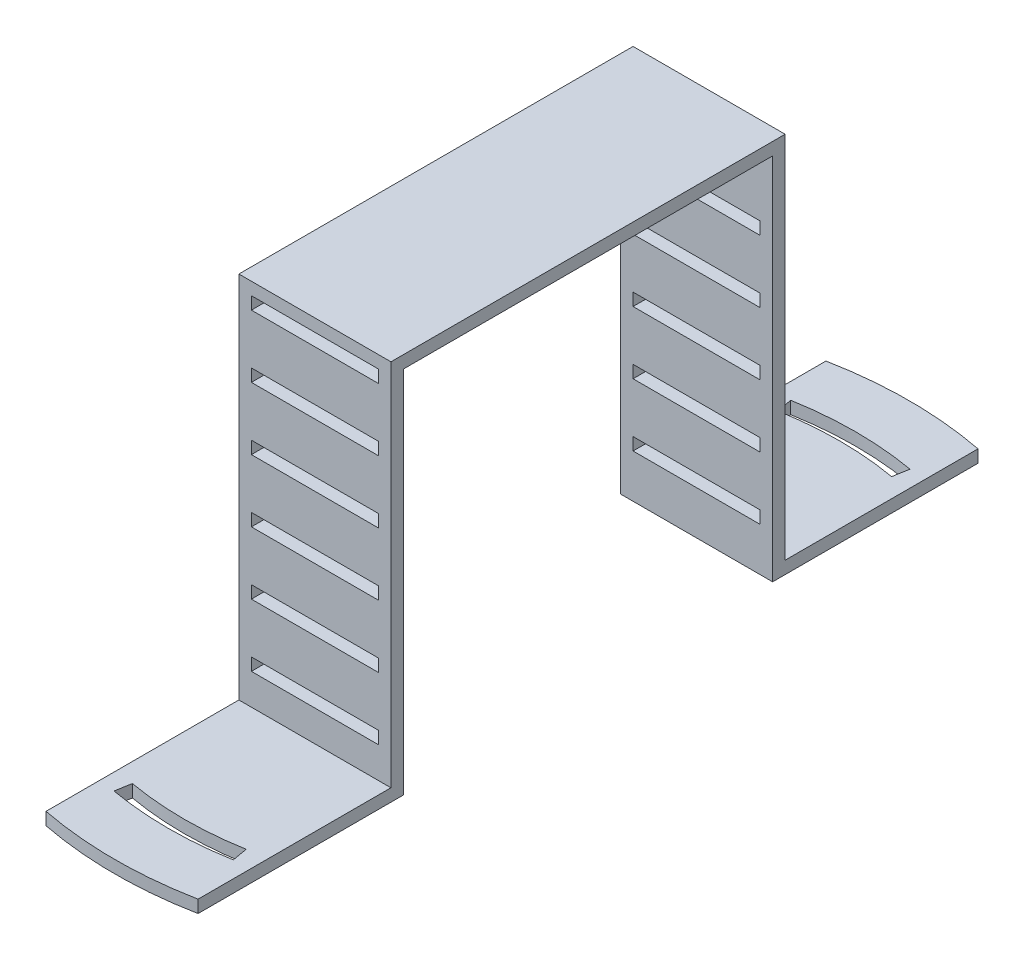
from build123d import *

# Parameters (mm, degrees)
SKETCH1_R            = 1.5875
BOSS_EXTRUDE5_DEPTH  = 1.5875
FILLET2_R            = 2.54
FILLET3_R            = 2.54
FILLET4_R            = 5.08
CUT_EXTRUDE1_START   = -2.54
SKETCH2_R            = 2.38125
SKETCH2_R_2          = 1.5875
CUT_EXTRUDE1_DEPTH   = 2.54
SKETCH3_R            = 1.5875
CUT_EXTRUDE2_DEPTH   = 2.54
CUT_EXTRUDE3_DEPTH   = 2.54
SKETCH5_W            = 15
SKETCH5_H            = 34.925
CUT_EXTRUDE4_DEPTH   = 109.650407999
FILLET5_R            = 7.62
FILLET6_R            = 7.62
BOSS_EXTRUDE6_START  = -1.5875
BOSS_EXTRUDE6_DEPTH  = 1.5875
SKETCH7_R            = 79.375
CUT_EXTRUDE5_DEPTH   = 0.5875
BOSS_EXTRUDE7_START  = -1
SKETCH8_R            = 1.5875
SKETCH8_R_2          = 2.38125
BOSS_EXTRUDE7_DEPTH  = 1
SKETCH9_R            = 1.5875
CUT_EXTRUDE7_DEPTH   = 2.54
BOSS_EXTRUDE8_START  = -1
BOSS_EXTRUDE8_DEPTH  = 1
CUT_EXTRUDE9_START   = -2.54
CUT_EXTRUDE9_DEPTH   = 2.54
BOSS_EXTRUDE9_START  = -1
BOSS_EXTRUDE9_DEPTH  = 1
CUT_EXTRUDE10_START  = -2.54
CUT_EXTRUDE10_DEPTH  = 2.54
BOSS_EXTRUDE10_START = -1
BOSS_EXTRUDE10_DEPTH = 1
CUT_EXTRUDE11_START  = -2.54
CUT_EXTRUDE11_DEPTH  = 2.54
BOSS_EXTRUDE11_START = -1
BOSS_EXTRUDE11_DEPTH = 1
BOSS_EXTRUDE13_DEPTH = 2.5
SKETCH19_W           = 73.75
SKETCH19_H           = 2.5
SKETCH19_W_2         = 2.5
SKETCH19_H_2         = 76.2
BOSS_EXTRUDE14_DEPTH = 30.380450628
CUT_EXTRUDE12_START  = -2.5
SKETCH20_R           = 79.375
CUT_EXTRUDE12_DEPTH  = 2.5
SKETCH21_W           = 25.380450628
SKETCH21_H           = 2.5
CUT_EXTRUDE15_DEPTH  = 143.7697468


with BuildPart() as part:
    # Sketch1 → Boss-Extrude5 (new body)
    with BuildSketch(Plane(origin=(0, 0, 0), x_dir=(1, 0, 0), z_dir=(0, 1, 0))):
        with BuildLine():
            ThreePointArc((-63.5, -47.625), (-35.497579143, -70.995158286), (0, -79.375))
            ThreePointArc((0, -79.375), (35.497579143, -70.995158286), (63.5, -47.625))
            Line((63.5, -47.625), (50.8, -47.625))
            Line((50.8, -47.625), (50.8, 22.225))
            Line((50.8, 22.225), (76.2, 22.225))
            ThreePointArc((76.2, 22.225), (0, 79.375), (-76.2, 22.225))
            Line((-76.2, 22.225), (-50.8, 22.225))
            Line((-50.8, 22.225), (-50.8, -47.625))
            Line((-50.8, -47.625), (-63.5, -47.625))
        make_face()
        with Locations(Location((-7.14375, -66.675, 0), (0, 0, 270))):
            Circle(SKETCH1_R, mode=Mode.SUBTRACT)
        with BuildLine():
            ThreePointArc((8.73125, -66.675), (7.14375, -68.2625), (5.55625, -66.675))
            ThreePointArc((5.55625, -66.675), (7.14375, -65.0875), (8.73125, -66.675))
        make_face(mode=Mode.SUBTRACT)
        with Locations(Location((-7.14375, 66.675, 0), (0, 0, 270))):
            Circle(SKETCH1_R, mode=Mode.SUBTRACT)
        with Locations(Location((7.14375, 66.675, 0), (0, 0, 270))):
            Circle(SKETCH1_R, mode=Mode.SUBTRACT)
    extrude(amount=BOSS_EXTRUDE5_DEPTH)

    # Fillet2
    fillet2_edges = [part.edges().sort_by_distance(p)[0] for p in [
        (-63.5, 0.79375, 47.625),
    ]]
    fillet(fillet2_edges, radius=FILLET2_R)

    # Fillet3
    fillet3_edges = [part.edges().sort_by_distance(p)[0] for p in [
        (63.5, 0.79375, 47.625),
    ]]
    fillet(fillet3_edges, radius=FILLET3_R)

    # Fillet4
    fillet4_edges = [part.edges().sort_by_distance(p)[0] for p in [
        (-76.2, 0.79375, -22.225),
        (76.2, 0.79375, -22.225),
    ]]
    fillet(fillet4_edges, radius=FILLET4_R)

    # Sketch2 → Cut-Extrude1 (cut)
    # profile 1 of 10: a face of its own
    with BuildSketch(Plane(origin=(0, 1.5875, 0), x_dir=(1, 0, 0), z_dir=(0, 1, 0)).offset(CUT_EXTRUDE1_START)):
        with BuildLine():
            Line((-61.088622125, 27.654457796), (-59.642408406, 26.999765402))
            ThreePointArc((-59.642408406, 26.999765402), (-52.384826382, 39.268743005), (-42.643785254, 49.676068599))
            Line((-42.643785254, 49.676068599), (-43.677815048, 50.880617741))
            Line((-43.677815048, 50.880617741), (-44.711844841, 52.085166883))
            ThreePointArc((-44.711844841, 52.085166883), (-54.925289002, 41.173126022), (-62.534835843, 28.309150189))
            Line((-62.534835843, 28.309150189), (-61.088622125, 27.654457796))
        make_face()
    # profile 2 of 10: a face of its own
    with BuildSketch(Plane(origin=(0, 1.5875, 0), x_dir=(1, 0, 0), z_dir=(0, 1, 0)).offset(CUT_EXTRUDE1_START)):
        with BuildLine():
            Line((-39.077069744, 54.493774041), (-38.151958122, 53.203686937))
            ThreePointArc((-38.151958122, 53.203686937), (-25.732218917, 60.200142208), (-12.092567045, 64.342629994))
            Line((-12.092567045, 64.342629994), (-12.385788543, 65.902815048))
            Line((-12.385788543, 65.902815048), (-12.679010041, 67.463000102))
            ThreePointArc((-12.679010041, 67.463000102), (-26.980132574, 63.119617589), (-40.002181367, 55.783861145))
            Line((-40.002181367, 55.783861145), (-39.077069744, 54.493774041))
        make_face()
    # profile 3 of 10: a face of its own
    with BuildSketch(Plane(origin=(0, 1.5875, 0), x_dir=(1, 0, 0), z_dir=(0, 1, 0)).offset(CUT_EXTRUDE1_START)):
        with Locations(Location((-7.14375, 66.675, 0), (0, 0, 270))):
            Circle(SKETCH2_R)
        with Locations((-7.14375, 66.675)):
            Circle(SKETCH2_R_2, mode=Mode.SUBTRACT)
    # profile 4 of 10: a face of its own
    with BuildSketch(Plane(origin=(0, 1.5875, 0), x_dir=(1, 0, 0), z_dir=(0, 1, 0)).offset(CUT_EXTRUDE1_START)):
        with Locations(Location((7.14375, 66.675, 0), (0, 0, 270))):
            Circle(SKETCH2_R)
        with Locations((7.14375, 66.675)):
            Circle(SKETCH2_R_2, mode=Mode.SUBTRACT)
    # profile 5 of 10: a face of its own
    with BuildSketch(Plane(origin=(0, 1.5875, 0), x_dir=(1, 0, 0), z_dir=(0, 1, 0)).offset(CUT_EXTRUDE1_START)):
        with BuildLine():
            ThreePointArc((12.679010041, 67.463000102), (26.980132574, 63.119617589), (40.002181367, 55.783861145))
            Line((40.002181367, 55.783861145), (39.077069744, 54.493774041))
            Line((39.077069744, 54.493774041), (38.151958122, 53.203686937))
            ThreePointArc((38.151958122, 53.203686937), (25.732218917, 60.200142208), (12.092567045, 64.342629994))
            Line((12.092567045, 64.342629994), (12.385788543, 65.902815048))
            Line((12.385788543, 65.902815048), (12.679010041, 67.463000102))
        make_face()
    # profile 6 of 10: a face of its own
    with BuildSketch(Plane(origin=(0, 1.5875, 0), x_dir=(1, 0, 0), z_dir=(0, 1, 0)).offset(CUT_EXTRUDE1_START)):
        with BuildLine():
            ThreePointArc((44.711844841, 52.085166883), (54.925289002, 41.173126022), (62.534835843, 28.309150189))
            Line((62.534835843, 28.309150189), (59.642408406, 26.999765402))
            ThreePointArc((59.642408406, 26.999765402), (52.384826382, 39.268743005), (42.643785254, 49.676068599))
            Line((42.643785254, 49.676068599), (43.677815048, 50.880617741))
            Line((43.677815048, 50.880617741), (44.711844841, 52.085166883))
        make_face()
    # profile 7 of 10: a face of its own
    with BuildSketch(Plane(origin=(0, 1.5875, 0), x_dir=(1, 0, 0), z_dir=(0, 1, 0)).offset(CUT_EXTRUDE1_START)):
        with BuildLine():
            ThreePointArc((-12.679010041, -67.463000102), (-26.980132574, -63.119617589), (-40.002181367, -55.783861145))
            Line((-40.002181367, -55.783861145), (-39.077069744, -54.493774041))
            Line((-39.077069744, -54.493774041), (-38.151958122, -53.203686937))
            ThreePointArc((-38.151958122, -53.203686937), (-25.732218917, -60.200142208), (-12.092567045, -64.342629994))
            Line((-12.092567045, -64.342629994), (-12.385788543, -65.902815048))
            Line((-12.385788543, -65.902815048), (-12.679010041, -67.463000102))
        make_face()
    # profile 8 of 10: a face of its own
    with BuildSketch(Plane(origin=(0, 1.5875, 0), x_dir=(1, 0, 0), z_dir=(0, 1, 0)).offset(CUT_EXTRUDE1_START)):
        with Locations(Location((-7.14375, -66.675, 0), (0, 0, 270))):
            Circle(SKETCH2_R)
        with Locations((-7.14375, -66.675)):
            Circle(SKETCH2_R_2, mode=Mode.SUBTRACT)
    # profile 9 of 10: a face of its own
    with BuildSketch(Plane(origin=(0, 1.5875, 0), x_dir=(1, 0, 0), z_dir=(0, 1, 0)).offset(CUT_EXTRUDE1_START)):
        with Locations(Location((7.14375, -66.675, 0), (0, 0, 270))):
            Circle(SKETCH2_R)
        with Locations((7.14375, -66.675)):
            Circle(SKETCH2_R_2, mode=Mode.SUBTRACT)
    # profile 10 of 10: a face of its own
    with BuildSketch(Plane(origin=(0, 1.5875, 0), x_dir=(1, 0, 0), z_dir=(0, 1, 0)).offset(CUT_EXTRUDE1_START)):
        with BuildLine():
            ThreePointArc((12.092567045, -64.342629994), (25.732218917, -60.200142208), (38.151958122, -53.203686937))
            Line((38.151958122, -53.203686937), (39.077069744, -54.493774041))
            Line((39.077069744, -54.493774041), (40.002181367, -55.783861145))
            ThreePointArc((40.002181367, -55.783861145), (26.980132574, -63.119617589), (12.679010041, -67.463000102))
            Line((12.679010041, -67.463000102), (12.385788543, -65.902815048))
            Line((12.385788543, -65.902815048), (12.092567045, -64.342629994))
        make_face()
    extrude(amount=CUT_EXTRUDE1_DEPTH, mode=Mode.SUBTRACT)

    # Sketch3 → Cut-Extrude2 (cut)
    with BuildSketch(Plane(origin=(0, 1.5875, 0), x_dir=(1, 0, 0), z_dir=(0, 1, 0))):
        with Locations(Location((-44.45, -47.625, 0), (0, 0, 270))):
            Circle(SKETCH3_R)
        with Locations(Location((-44.45, 22.225, 0), (0, 0, 270))):
            Circle(SKETCH3_R)
        with Locations(Location((44.45, 22.225, 0), (0, 0, 270))):
            Circle(SKETCH3_R)
        with Locations(Location((44.45, -47.625, 0), (0, 0, 270))):
            Circle(SKETCH3_R)
    extrude(amount=-CUT_EXTRUDE2_DEPTH, mode=Mode.SUBTRACT)

    # Sketch4 → Cut-Extrude3 (cut)
    with BuildSketch(Plane(origin=(0, 1.5875, 0), x_dir=(1, 0, 0), z_dir=(0, 1, 0))):
        with BuildLine():
            ThreePointArc((-44.45, -11.1125), (-46.0375, -12.7), (-44.45, -14.2875))
            Line((-44.45, -14.2875), (-44.45, -11.1125))
        make_face()
        with BuildLine():
            Line((-44.45, -11.1125), (-44.45, -14.2875))
            ThreePointArc((-44.45, -14.2875), (-43.327467985, -13.822532015), (-42.8625, -12.7))
            ThreePointArc((-42.8625, -12.7), (-43.327467985, -11.577467985), (-44.45, -11.1125))
        make_face()
        with BuildLine():
            ThreePointArc((44.45, -11.1125), (42.8625, -12.7), (44.45, -14.2875))
            Line((44.45, -14.2875), (44.45, -11.1125))
        make_face()
        with BuildLine():
            Line((44.45, -11.1125), (44.45, -14.2875))
            ThreePointArc((44.45, -14.2875), (45.572532015, -13.822532015), (46.0375, -12.7))
            ThreePointArc((46.0375, -12.7), (45.572532015, -11.577467985), (44.45, -11.1125))
        make_face()
    extrude(amount=-CUT_EXTRUDE3_DEPTH, mode=Mode.SUBTRACT)

    # Sketch5 → Cut-Extrude4 (cut, through all)
    with BuildSketch(Plane(origin=(0, 1.5875, 0), x_dir=(1, 0, 0), z_dir=(0, 1, 0))):
        with Locations((-27.3, 4.7625)):
            Rectangle(SKETCH5_W, SKETCH5_H)
        with Locations((27.3, 4.7625)):
            Rectangle(SKETCH5_W, SKETCH5_H)
    extrude(amount=-CUT_EXTRUDE4_DEPTH, mode=Mode.SUBTRACT)

    # Fillet5
    # the kernel refuses this fillet: 7.62 mm, written as the material it adds along each edge
    with BuildSketch(Plane(origin=(-19.8, 1.5875, 12.7), x_dir=(0, 0, -1), z_dir=(0, -1, 0))) as fillet5_piece_1:
        with BuildLine():
            CenterArc((FILLET5_R, -FILLET5_R), FILLET5_R, 90, 90)
            Line((0, -FILLET5_R), (0, 0))
            Line((0, 0), (FILLET5_R, 0))
        make_face()
    extrude(amount=1.5875)
    with BuildSketch(Plane(origin=(-34.8, 1.5875, 12.7), x_dir=(0, 0, -1), z_dir=(0, -1, 0)), Plane(origin=(-19.8, 1.5875, -22.225), x_dir=(0, 0, 1), z_dir=(0, -1, 0)), Plane(origin=(-34.8, 1.5875, -22.225), x_dir=(1, 0, 0), z_dir=(0, -1, 0))) as fillet5_piece_2:
        with BuildLine():
            CenterArc((FILLET5_R, FILLET5_R), FILLET5_R, 180, 90)
            Line((0, FILLET5_R), (0, 0))
            Line((0, 0), (FILLET5_R, 0))
        make_face()
    extrude(amount=1.5875)

    # Fillet6
    # the kernel refuses this fillet: 7.62 mm, written as the material it adds along each edge
    with BuildSketch(Plane(origin=(34.8, 1.5875, 12.7), x_dir=(0, 0, -1), z_dir=(0, -1, 0)), Plane(origin=(34.8, 1.5875, -22.225), x_dir=(-1, 0, 0), z_dir=(0, -1, 0))) as fillet6_piece_1:
        with BuildLine():
            CenterArc((FILLET6_R, -FILLET6_R), FILLET6_R, 90, 90)
            Line((0, -FILLET6_R), (0, 0))
            Line((0, 0), (FILLET6_R, 0))
        make_face()
    extrude(amount=1.5875)
    with BuildSketch(Plane(origin=(19.8, 1.5875, -22.225), x_dir=(1, 0, 0), z_dir=(0, -1, 0)), Plane(origin=(19.8, 1.5875, 12.7), x_dir=(0, 0, -1), z_dir=(0, -1, 0))) as fillet6_piece_2:
        with BuildLine():
            CenterArc((FILLET6_R, FILLET6_R), FILLET6_R, 180, 90)
            Line((0, FILLET6_R), (0, 0))
            Line((0, 0), (FILLET6_R, 0))
        make_face()
    extrude(amount=1.5875)

    # Sketch6 → Boss-Extrude6 (add)
    with BuildSketch(Plane(origin=(0, 1.5875, 0), x_dir=(1, 0, 0), z_dir=(0, 1, 0)).offset(BOSS_EXTRUDE6_START)):
        with BuildLine():
            Line((-50.8, -60.989758362), (-50.8, 22.225))
            Line((-50.8, 22.225), (-69.095470184, 22.225))
            Line((-69.095470184, 22.225), (-69.095470184, 39.066694575))
            ThreePointArc((-69.095470184, 39.066694575), (-78.080435361, -14.277122916), (-50.8, -60.989758362))
        make_face()
        with BuildLine():
            Line((50.8, 22.225), (50.8, -60.989758362))
            ThreePointArc((50.8, -60.989758362), (71.877119534, -33.675960454), (79.375, 0))
            ThreePointArc((79.375, 0), (76.762111653, 20.198238526), (69.095470184, 39.066694575))
            Line((69.095470184, 39.066694575), (69.095470184, 22.225))
            Line((69.095470184, 22.225), (50.8, 22.225))
        make_face()
    extrude(amount=BOSS_EXTRUDE6_DEPTH)

    # Sketch7 → Cut-Extrude5 (cut)
    with BuildSketch(Plane.XZ):
        with Locations(Location((0, 0, 0), (0, 0, 270))):
            Circle(SKETCH7_R)
    extrude(amount=-CUT_EXTRUDE5_DEPTH, mode=Mode.SUBTRACT)

    # Sketch8 → Boss-Extrude7 (add)
    with BuildSketch(Plane(origin=(0, 1.5875, 0), x_dir=(1, 0, 0), z_dir=(0, 1, 0)).offset(BOSS_EXTRUDE7_START)):
        with Locations((-44.45, -12.7)):
            Circle(SKETCH8_R)
        with Locations((44.45, -12.7)):
            Circle(SKETCH8_R)
        with Locations((-7.14375, -66.675)):
            Circle(SKETCH8_R_2)
        with Locations((7.14375, -66.675)):
            Circle(SKETCH8_R_2)
        with Locations((-7.14375, 66.675)):
            Circle(SKETCH8_R_2)
        with Locations((7.14375, 66.675)):
            Circle(SKETCH8_R_2)
    extrude(amount=BOSS_EXTRUDE7_DEPTH)

    # Sketch9 → Cut-Extrude7 (cut)
    with BuildSketch(Plane(origin=(0, 1.5875, 0), x_dir=(1, 0, 0), z_dir=(0, 1, 0))):
        with Locations(Location((-44.45, -1.058333333, 0), (0, 0, 270))):
            Circle(SKETCH9_R)
        with Locations(Location((-44.45, -24.341666667, 0), (0, 0, 270))):
            Circle(SKETCH9_R)
        with Locations(Location((44.45, -24.341666667, 0), (0, 0, 270))):
            Circle(SKETCH9_R)
        with Locations(Location((44.45, -1.058333333, 0), (0, 0, 270))):
            Circle(SKETCH9_R)
    extrude(amount=-CUT_EXTRUDE7_DEPTH, mode=Mode.SUBTRACT)

    # Sketch10 → Boss-Extrude8 (add)
    with BuildSketch(Plane(origin=(0, 1.5875, 0), x_dir=(1, 0, 0), z_dir=(0, 1, 0)).offset(BOSS_EXTRUDE8_START)):
        with BuildLine():
            Line((-44.711844841, 52.085166883), (-42.643785254, 49.676068599))
            ThreePointArc((-42.643785254, 49.676068599), (-52.384826382, 39.268743005), (-59.642408406, 26.999765402))
            Line((-59.642408406, 26.999765402), (-62.534835843, 28.309150189))
            ThreePointArc((-62.534835843, 28.309150189), (-54.925289002, 41.173126022), (-44.711844841, 52.085166883))
        make_face()
        with BuildLine():
            Line((-12.679010041, 67.463000102), (-12.092567045, 64.342629994))
            ThreePointArc((-12.092567045, 64.342629994), (-25.732218917, 60.200142208), (-38.151958122, 53.203686937))
            Line((-38.151958122, 53.203686937), (-40.002181367, 55.783861145))
            ThreePointArc((-40.002181367, 55.783861145), (-26.980132574, 63.119617589), (-12.679010041, 67.463000102))
        make_face()
        with BuildLine():
            Line((12.092567045, 64.342629994), (12.679010041, 67.463000102))
            ThreePointArc((12.679010041, 67.463000102), (26.980132574, 63.119617589), (40.002181367, 55.783861145))
            Line((40.002181367, 55.783861145), (38.151958122, 53.203686937))
            ThreePointArc((38.151958122, 53.203686937), (25.732218917, 60.200142208), (12.092567045, 64.342629994))
        make_face()
        with BuildLine():
            Line((42.643785254, 49.676068599), (44.711844841, 52.085166883))
            ThreePointArc((44.711844841, 52.085166883), (54.925289002, 41.173126022), (62.534835843, 28.309150189))
            Line((62.534835843, 28.309150189), (59.642408406, 26.999765402))
            ThreePointArc((59.642408406, 26.999765402), (52.384826382, 39.268743005), (42.643785254, 49.676068599))
        make_face()
    extrude(amount=BOSS_EXTRUDE8_DEPTH)

    # Sketch11 → Cut-Extrude9 (cut)
    with BuildSketch(Plane(origin=(0, 1.5875, 0), x_dir=(1, 0, 0), z_dir=(0, 1, 0)).offset(CUT_EXTRUDE9_START)):
        with BuildLine():
            Line((11.919924408, -67.601250584), (11.368591443, -64.474485968))
            ThreePointArc((11.368591443, -64.474485968), (0, -65.46910884), (-11.368591443, -64.474485968))
            Line((-11.368591443, -64.474485968), (-11.919924408, -67.601250584))
            ThreePointArc((-11.919924408, -67.601250584), (0, -68.64410884), (11.919924408, -67.601250584))
        make_face()
        with BuildLine():
            Line((-11.919924408, 67.601250584), (-11.368591443, 64.474485968))
            ThreePointArc((-11.368591443, 64.474485968), (0, 65.46910884), (11.368591443, 64.474485968))
            Line((11.368591443, 64.474485968), (11.919924408, 67.601250584))
            ThreePointArc((11.919924408, 67.601250584), (0, 68.64410884), (-11.919924408, 67.601250584))
        make_face()
        with BuildLine():
            Line((-48.538714849, 48.538714849), (-46.293650819, 46.293650819))
            ThreePointArc((-46.293650819, 46.293650819), (-42.082731979, 50.152247023), (-37.551538139, 53.629154344))
            Line((-37.551538139, 53.629154344), (-39.372643325, 56.229962084))
            ThreePointArc((-39.372643325, 56.229962084), (-44.12358264, 52.584438129), (-48.538714849, 48.538714849))
        make_face()
        with BuildLine():
            ThreePointArc((-53.629154344, 37.551538139), (-50.152247023, 42.082731979), (-46.293650819, 46.293650819))
            Line((-46.293650819, 46.293650819), (-48.538714849, 48.538714849))
            ThreePointArc((-48.538714849, 48.538714849), (-52.584438129, 44.12358264), (-56.229962084, 39.372643325))
            Line((-56.229962084, 39.372643325), (-53.629154344, 37.551538139))
        make_face()
        with BuildLine():
            Line((-68.64410884, 0), (-65.46910884, 0))
            ThreePointArc((-65.46910884, 0), (-65.219979115, 5.706008808), (-64.474485968, 11.368591443))
            Line((-64.474485968, 11.368591443), (-67.601250584, 11.919924408))
            ThreePointArc((-67.601250584, 11.919924408), (-68.382897281, 5.982728291), (-68.64410884, 0))
        make_face()
        with BuildLine():
            ThreePointArc((-64.474485968, -11.368591443), (-65.219979115, -5.706008808), (-65.46910884, 0))
            Line((-65.46910884, 0), (-68.64410884, 0))
            ThreePointArc((-68.64410884, 0), (-68.382897281, -5.982728291), (-67.601250584, -11.919924408))
            Line((-67.601250584, -11.919924408), (-64.474485968, -11.368591443))
        make_face()
        with BuildLine():
            Line((67.601250584, 11.919924408), (64.474485968, 11.368591443))
            ThreePointArc((64.474485968, 11.368591443), (65.219979115, 5.706008808), (65.46910884, 0))
            ThreePointArc((65.46910884, 0), (65.219979115, -5.706008808), (64.474485968, -11.368591443))
            Line((64.474485968, -11.368591443), (67.601250584, -11.919924408))
            ThreePointArc((67.601250584, -11.919924408), (68.382897281, -5.982728291), (68.64410884, 0))
            ThreePointArc((68.64410884, 0), (68.382897281, 5.982728291), (67.601250584, 11.919924408))
        make_face()
        with BuildLine():
            Line((48.538714849, 48.538714849), (46.293650819, 46.293650819))
            ThreePointArc((46.293650819, 46.293650819), (50.152247023, 42.082731979), (53.629154344, 37.551538139))
            Line((53.629154344, 37.551538139), (56.229962084, 39.372643325))
            ThreePointArc((56.229962084, 39.372643325), (52.584438129, 44.12358264), (48.538714849, 48.538714849))
        make_face()
        with BuildLine():
            ThreePointArc((37.551538139, 53.629154344), (42.082731979, 50.152247023), (46.293650819, 46.293650819))
            Line((46.293650819, 46.293650819), (48.538714849, 48.538714849))
            ThreePointArc((48.538714849, 48.538714849), (44.12358264, 52.584438129), (39.372643325, 56.229962084))
            Line((39.372643325, 56.229962084), (37.551538139, 53.629154344))
        make_face()
    extrude(amount=CUT_EXTRUDE9_DEPTH, mode=Mode.SUBTRACT)

    # Sketch12 → Boss-Extrude9 (add)
    with BuildSketch(Plane(origin=(0, 1.5875, 0), x_dir=(1, 0, 0), z_dir=(0, 1, 0)).offset(BOSS_EXTRUDE9_START)):
        with BuildLine():
            ThreePointArc((-12.092567045, -64.342629994), (-14.887643702, -63.753919701), (-17.654380884, -63.043850199))
            Line((-17.654380884, -63.043850199), (-18.510550462, -66.101234482))
            ThreePointArc((-18.510550462, -66.101234482), (-15.609637167, -66.845739624), (-12.679010041, -67.463000102))
            Line((-12.679010041, -67.463000102), (-12.092567045, -64.342629994))
        make_face()
        with BuildLine():
            Line((18.510550462, -66.101234482), (17.654380884, -63.043850199))
            ThreePointArc((17.654380884, -63.043850199), (14.887643702, -63.753919701), (12.092567045, -64.342629994))
            Line((12.092567045, -64.342629994), (12.679010041, -67.463000102))
            ThreePointArc((12.679010041, -67.463000102), (15.609637167, -66.845739624), (18.510550462, -66.101234482))
        make_face()
    extrude(amount=BOSS_EXTRUDE9_DEPTH)

    # Sketch13 → Cut-Extrude10 (cut)
    with BuildSketch(Plane(origin=(0, 1.5875, 0), x_dir=(1, 0, 0), z_dir=(0, 1, 0)).offset(CUT_EXTRUDE10_START)):
        with BuildLine():
            Line((-52.584438129, -44.12358264), (-50.152247023, -42.082731979))
            ThreePointArc((-50.152247023, -42.082731979), (-56.697911418, -32.73455442), (-61.520838466, -22.391753989))
            Line((-61.520838466, -22.391753989), (-64.504362537, -23.477667944))
            ThreePointArc((-64.504362537, -23.477667944), (-59.447542075, -34.32205442), (-52.584438129, -44.12358264))
        make_face()
        with BuildLine():
            Line((64.504362537, -23.477667944), (61.520838466, -22.391753989))
            ThreePointArc((61.520838466, -22.391753989), (56.697911418, -32.73455442), (50.152247023, -42.082731979))
            Line((50.152247023, -42.082731979), (52.584438129, -44.12358264))
            ThreePointArc((52.584438129, -44.12358264), (59.447542075, -34.32205442), (64.504362537, -23.477667944))
        make_face()
        with BuildLine():
            Line((52.584438129, 44.12358264), (50.152247023, 42.082731979))
            ThreePointArc((50.152247023, 42.082731979), (56.697911418, 32.73455442), (61.520838466, 22.391753989))
            Line((61.520838466, 22.391753989), (64.504362537, 23.477667944))
            ThreePointArc((64.504362537, 23.477667944), (59.447542075, 34.32205442), (52.584438129, 44.12358264))
        make_face()
        with BuildLine():
            Line((23.477667944, 64.504362537), (22.391753989, 61.520838466))
            ThreePointArc((22.391753989, 61.520838466), (32.73455442, 56.697911418), (42.082731979, 50.152247023))
            Line((42.082731979, 50.152247023), (44.12358264, 52.584438129))
            ThreePointArc((44.12358264, 52.584438129), (34.32205442, 59.447542075), (23.477667944, 64.504362537))
        make_face()
        with BuildLine():
            Line((-44.12358264, 52.584438129), (-42.082731979, 50.152247023))
            ThreePointArc((-42.082731979, 50.152247023), (-32.73455442, 56.697911418), (-22.391753989, 61.520838466))
            Line((-22.391753989, 61.520838466), (-23.477667944, 64.504362537))
            ThreePointArc((-23.477667944, 64.504362537), (-34.32205442, 59.447542075), (-44.12358264, 52.584438129))
        make_face()
        with BuildLine():
            Line((-64.504362537, 23.477667944), (-61.520838466, 22.391753989))
            ThreePointArc((-61.520838466, 22.391753989), (-56.697911418, 32.73455442), (-50.152247023, 42.082731979))
            Line((-50.152247023, 42.082731979), (-52.584438129, 44.12358264))
            ThreePointArc((-52.584438129, 44.12358264), (-59.447542075, 34.32205442), (-64.504362537, 23.477667944))
        make_face()
    extrude(amount=CUT_EXTRUDE10_DEPTH, mode=Mode.SUBTRACT)

    # Sketch15 → Boss-Extrude10 (add)
    with BuildSketch(Plane(origin=(0, 1.5875, 0), x_dir=(1, 0, 0), z_dir=(0, 1, 0)).offset(BOSS_EXTRUDE10_START)):
        with BuildLine():
            Line((-52.584438129, 44.12358264), (-50.152247023, 42.082731979))
            ThreePointArc((-50.152247023, 42.082731979), (-46.293650819, 46.293650819), (-42.082731979, 50.152247023))
            Line((-42.082731979, 50.152247023), (-44.12358264, 52.584438129))
            ThreePointArc((-44.12358264, 52.584438129), (-48.538714849, 48.538714849), (-52.584438129, 44.12358264))
        make_face()
        with BuildLine():
            Line((44.12358264, 52.584438129), (42.082731979, 50.152247023))
            ThreePointArc((42.082731979, 50.152247023), (46.293650819, 46.293650819), (50.152247023, 42.082731979))
            Line((50.152247023, 42.082731979), (52.584438129, 44.12358264))
            ThreePointArc((52.584438129, 44.12358264), (48.538714849, 48.538714849), (44.12358264, 52.584438129))
        make_face()
    extrude(amount=BOSS_EXTRUDE10_DEPTH)

    # Sketch16 → Cut-Extrude11 (cut)
    with BuildSketch(Plane(origin=(0, 1.5875, 0), x_dir=(1, 0, 0), z_dir=(0, 1, 0)).offset(CUT_EXTRUDE11_START)):
        with BuildLine():
            Line((-23.477667944, -64.504362537), (-22.391753989, -61.520838466))
            ThreePointArc((-22.391753989, -61.520838466), (-32.73455442, -56.697911418), (-42.082731979, -50.152247022))
            Line((-42.082731979, -50.152247022), (-44.12358264, -52.584438129))
            ThreePointArc((-44.12358264, -52.584438129), (-34.32205442, -59.447542075), (-23.477667944, -64.504362537))
        make_face()
        with BuildLine():
            ThreePointArc((42.082731979, -50.152247022), (32.73455442, -56.697911418), (22.391753989, -61.520838466))
            Line((22.391753989, -61.520838466), (23.477667944, -64.504362537))
            ThreePointArc((23.477667944, -64.504362537), (34.32205442, -59.447542075), (44.12358264, -52.584438129))
            Line((44.12358264, -52.584438129), (42.082731979, -50.152247022))
        make_face()
    extrude(amount=CUT_EXTRUDE11_DEPTH, mode=Mode.SUBTRACT)

    # Sketch17 → Boss-Extrude11 (add)
    with BuildSketch(Plane(origin=(0, 1.5875, 0), x_dir=(1, 0, 0), z_dir=(0, 1, 0)).offset(BOSS_EXTRUDE11_START)):
        with BuildLine():
            Line((-11.919924408, -67.601250584), (-11.368591443, -64.474485968))
            ThreePointArc((-11.368591443, -64.474485968), (-16.944652234, -63.238303052), (-22.391753989, -61.520838466))
            Line((-22.391753989, -61.520838466), (-23.477667944, -64.504362537))
            ThreePointArc((-23.477667944, -64.504362537), (-17.766402702, -66.305117551), (-11.919924408, -67.601250584))
        make_face()
        with BuildLine():
            ThreePointArc((22.391753989, -61.520838466), (16.944652234, -63.238303052), (11.368591443, -64.474485968))
            Line((11.368591443, -64.474485968), (11.919924408, -67.601250584))
            ThreePointArc((11.919924408, -67.601250584), (17.766402702, -66.305117551), (23.477667944, -64.504362537))
            Line((23.477667944, -64.504362537), (22.391753989, -61.520838466))
        make_face()
    extrude(amount=BOSS_EXTRUDE11_DEPTH)

    # Sketch18 → Boss-Extrude13 (add)
    # profile 1 of 3: a face of its own
    with BuildSketch(Plane(origin=(0, 1.5875, 0), x_dir=(1, 0, 0), z_dir=(0, 1, 0))):
        with BuildLine():
            ThreePointArc((15.190225314, 77.907943625), (0, 79.375), (-15.190225314, 77.907943625))
            Line((-15.190225314, 77.907943625), (-15.190225314, 39.375))
            Line((-15.190225314, 39.375), (0, 39.375))
            Line((0, 39.375), (15.190225314, 39.375))
            Line((15.190225314, 39.375), (15.190225314, 77.907943625))
        make_face()
        with BuildLine():
            Line((11.919924408, 67.601250584), (11.368591443, 64.474485968))
            ThreePointArc((11.368591443, 64.474485968), (0, 65.46910884), (-11.368591443, 64.474485968))
            Line((-11.368591443, 64.474485968), (-11.919924408, 67.601250584))
            ThreePointArc((-11.919924408, 67.601250584), (0, 68.64410884), (11.919924408, 67.601250584))
        make_face(mode=Mode.SUBTRACT)
    # profile 2 of 3: a face of its own
    with BuildSketch(Plane(origin=(0, 1.5875, 0), x_dir=(1, 0, 0), z_dir=(0, 1, 0))):
        with BuildLine():
            Line((-15.190225314, -39.375), (-15.190225314, -77.907943625))
            ThreePointArc((-15.190225314, -77.907943625), (-7.630452141, -79.007384624), (0, -79.375))
            Line((0, -79.375), (0, -68.64410884))
            ThreePointArc((0, -68.64410884), (-5.982728291, -68.382897281), (-11.919924408, -67.601250584))
            Line((-11.919924408, -67.601250584), (-11.368591443, -64.474485968))
            ThreePointArc((-11.368591443, -64.474485968), (-5.706008808, -65.219979115), (0, -65.46910884))
            Line((0, -65.46910884), (0, -39.375))
            Line((0, -39.375), (-15.190225314, -39.375))
        make_face()
    # profile 3 of 3: a face of its own
    with BuildSketch(Plane(origin=(0, 1.5875, 0), x_dir=(1, 0, 0), z_dir=(0, 1, 0))):
        with BuildLine():
            Line((0, -68.64410884), (0, -79.375))
            ThreePointArc((0, -79.375), (7.630452141, -79.007384624), (15.190225314, -77.907943625))
            Line((15.190225314, -77.907943625), (15.190225314, -39.375))
            Line((15.190225314, -39.375), (0, -39.375))
            Line((0, -39.375), (0, -65.46910884))
            ThreePointArc((0, -65.46910884), (5.706008808, -65.219979115), (11.368591443, -64.474485968))
            Line((11.368591443, -64.474485968), (11.919924408, -67.601250584))
            ThreePointArc((11.919924408, -67.601250584), (5.982728291, -68.382897281), (0, -68.64410884))
        make_face()
    extrude(amount=BOSS_EXTRUDE13_DEPTH)

    # Sketch19 → Boss-Extrude14 (add)
    with BuildSketch(Plane(origin=(15.190225314, 0, 0), x_dir=(0, 0, -1), z_dir=(1, 0, 0))):
        Polygon((-39.375, 4.0875), (-39.375, 1.5875), (-36.875, 1.5875), (-36.875, 75.2875), (-36.875, 77.7875), (-39.375, 77.7875), align=None)
        with Locations((0, 76.5375)):
            Rectangle(SKETCH19_W, SKETCH19_H)
        with Locations((38.125, 39.6875)):
            Rectangle(SKETCH19_W_2, SKETCH19_H_2)
    extrude(amount=-BOSS_EXTRUDE14_DEPTH)

    # Sketch20 → Cut-Extrude12 (cut)
    with BuildSketch(Plane(origin=(0, 1.5875, 0), x_dir=(1, 0, 0), z_dir=(0, 1, 0)).offset(CUT_EXTRUDE12_START)):
        Circle(SKETCH20_R)
    extrude(amount=CUT_EXTRUDE12_DEPTH, mode=Mode.SUBTRACT)

    # Sketch21 → Cut-Extrude15 (cut, through all)
    with BuildSketch(Plane(origin=(0, 0, -39.375), x_dir=(-1, 0, 0), z_dir=(0, 0, -1))):
        with Locations((0, 74.0375)):
            Rectangle(SKETCH21_W, SKETCH21_H)
        with Locations((0, 61.5375)):
            Rectangle(SKETCH21_W, SKETCH21_H)
        with Locations((0, 49.0375)):
            Rectangle(SKETCH21_W, SKETCH21_H)
        with Locations((0, 36.5375)):
            Rectangle(SKETCH21_W, SKETCH21_H)
        with Locations((0, 24.0375)):
            Rectangle(SKETCH21_W, SKETCH21_H)
        with Locations((0, 11.5375)):
            Rectangle(SKETCH21_W, SKETCH21_H)
    extrude(amount=-CUT_EXTRUDE15_DEPTH, mode=Mode.SUBTRACT)


solid = part.part
